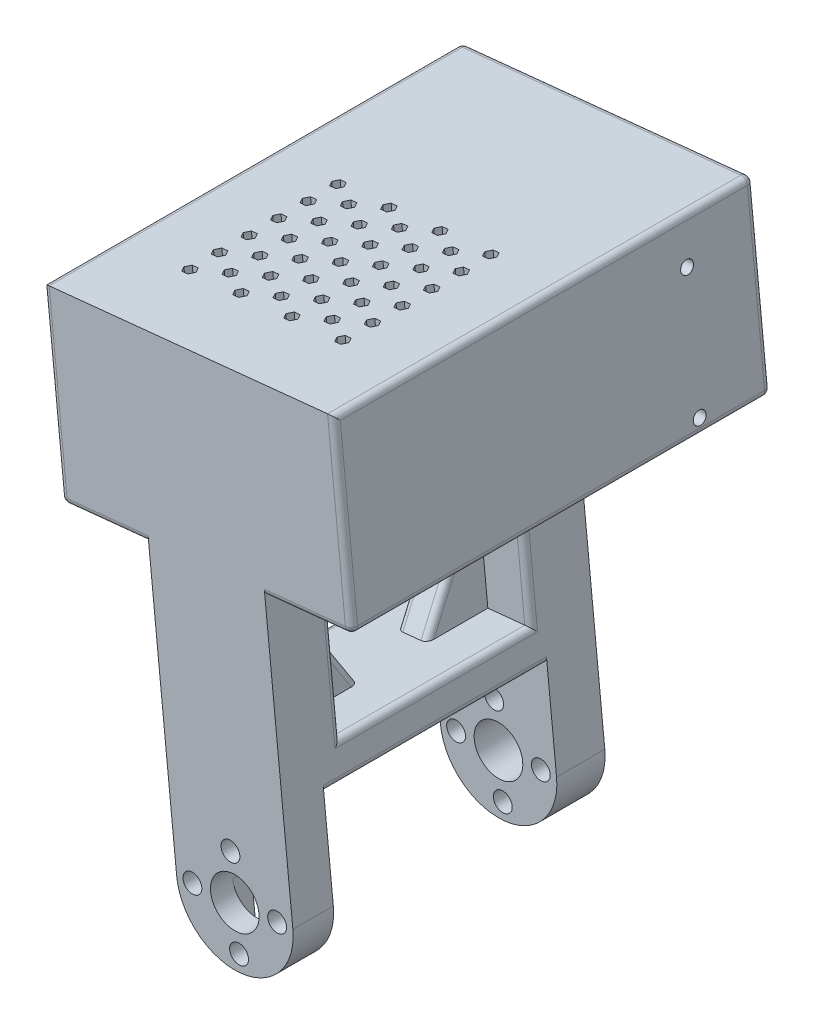
from build123d import *

# Parameters (mm, degrees)
SKETCH_1_R            = 1.55
EXTRUDE_1_DEPTH       = 50
CUT_EXTRUDE_2_REACH   = 161.914
SKETCH_2_W            = 36.7
SKETCH_2_H            = 25
EXTRUDE_START         = 1.28
SKETCH_4_R            = 1.55
EXTRUDE_2_DEPTH       = 1.28
SKETCH_5_W            = 19.2
SKETCH_5_H            = 10
EXTRUDE_3_DEPTH       = 48.978671901
EXTRUDE_4_DEPTH       = 9.4
EXTRUDE_4_DEPTH_BACK  = 28.6
SKETCH_6_W            = 51.28
SKETCH_6_H            = 24.952872663
EXTRUDE_5_DEPTH       = 29.648516482
EXTRUDE_7_DEPTH       = 5
EXTRUDE_8_DEPTH       = 5
EXTRUDE_9_DEPTH       = 5
SKETCH_15_R           = 1.05
CUT_EXTRUDE_5_DEPTH   = 7.998043226
SKETCH_17_W           = 37.211245045
SKETCH_17_H           = 31.485963651
EXTRUDE_11_DEPTH      = 4.9
CUT_EXTRUDE_START     = -7.957085393
SKETCH_16_R           = 1.05
CUT_EXTRUDE_6_DEPTH   = 7.957085393
RIB_15_REACH          = 180.646
SKETCH_26_WALL_W      = 20.054094066
SKETCH_26_WALL_H      = 5
EXTRUDE_14_DEPTH      = 2.5
EXTRUDE_14_DEPTH_BACK = 2.5
SKETCH_29_R           = 11
CUT_EXTRUDE_8_DEPTH   = 184.353804834
CUT_EXTRUDE_9_REACH   = 120.011
EXTRUDE_17_REACH      = 182.55
CUT_EXTRUDE_10_REACH  = 97.574
OTHER_START           = -77.6629689
OTHER_3_DEPTH         = 29.952872663
CUT_EXTRUDE_START_2   = -14.676203
SKETCH_34_W           = 8.000602369
SKETCH_34_H           = 3
CUT_EXTRUDE_11_DEPTH  = 9.6
CUT_EXTRUDE_START_3   = -51.28
SKETCH_35_R           = 4
CUT_EXTRUDE_12_DEPTH  = 51.28
CUT_EXTRUDE_13_DEPTH  = 183.048943079
FILLET_1_R            = 1


# Read off the part's stored shape, not the designer's step: 填充阵列3
with BuildPart() as part:
    # 草图1 → 凸台-拉伸1 (new body)
    with BuildSketch(Plane(origin=(0, 0, 106.7), x_dir=(0.9948490747861963, 0.10136724518822188, 0), z_dir=(0, 0, 1))):
        with BuildLine():
            Line((-9.975241789, 2.3862989), (-9.975241789, 23.684296999))
            Line((-9.975241789, 23.684296999), (9.224758211, 23.684296999))
            Line((9.224758211, 23.684296999), (9.224758211, 2.3862989))
            ThreePointArc((9.224758211, 2.3862989), (-0.375241789, -7.2137011), (-9.975241789, 2.3862989))
        make_face()
        with Locations(Location((-0.375241789, 9.3862989, 0), (0, 0, 354.182092032))):
            Circle(SKETCH_1_R, mode=Mode.SUBTRACT)
        with Locations(Location((6.625764906, 2.3862989, 0), (0, 0, 354.182092032))):
            Circle(SKETCH_1_R, mode=Mode.SUBTRACT)
        with Locations(Location((-7.374235094, 2.3862989, 0), (0, 0, 354.182092032))):
            Circle(SKETCH_1_R, mode=Mode.SUBTRACT)
        with Locations(Location((-0.375241789, -4.6137011, 0), (0, 0, 354.182092032))):
            Circle(SKETCH_1_R, mode=Mode.SUBTRACT)
    extrude(amount=EXTRUDE_1_DEPTH)

    # 切除-拉伸2: up to this face of the body (flat: up to its plane)
    cut_extrude_2_end = Plane(part.part.faces().sort_by_distance((-11.245212308, 11.956991324, 131.7))[0])
    # 草图2 → 切除-拉伸2 (cut, up to the picked face)
    with BuildSketch(Plane(origin=(9.177242172, 0.935088327, 0), x_dir=(0, 0, -1), z_dir=(0.9948490747861964, 0.101367245188222, 0)), mode=Mode.PRIVATE) as cut_extrude_2_sk1:
        with Locations((-131.7, 5.2862989)):
            Rectangle(SKETCH_2_W, SKETCH_2_H)
    cut_extrude_2_tool1 = split(extrude(cut_extrude_2_sk1.sketch, amount=-CUT_EXTRUDE_2_REACH, mode=Mode.PRIVATE), bisect_by=cut_extrude_2_end, keep=Keep.BOTH, mode=Mode.PRIVATE)
    add(cut_extrude_2_tool1.solids().sort_by(Axis((8.641385, 6.194158, 131.7), (-0.9948490747861964, -0.101367245188222, 0)))[0], mode=Mode.SUBTRACT)

    # 草图4 → 凸台-拉伸2 (add)
    with BuildSketch(Plane(origin=(0, 0, 106.7), x_dir=(-1, 0, 0), z_dir=(0, 0, -1)).offset(EXTRUDE_START)):
        with BuildLine():
            Line((10.16575261, 1.362844473), (12.324672005, 22.551138176))
            Line((12.324672005, 22.551138176), (-6.776430231, 24.497389284))
            Line((-6.776430231, 24.497389284), (-8.935349626, 3.30909558))
            ThreePointArc((-8.935349626, 3.30909558), (-0.357924062, -7.214581091), (10.16575261, 1.362844473))
        make_face()
        with Locations(Location((-6.349743541, 3.045642789, 0), (0, 0, 180))):
            Circle(SKETCH_4_R, mode=Mode.SUBTRACT)
        with Locations(Location((-0.094369224, -4.627973497, 0), (0, 0, 180))):
            Circle(SKETCH_4_R, mode=Mode.SUBTRACT)
        with Locations(Location((7.578143506, 1.626501356, 0), (0, 0, 180))):
            Circle(SKETCH_4_R, mode=Mode.SUBTRACT)
        with Locations(Location((1.324772208, 9.29991355, 0), (0, 0, 180))):
            Circle(SKETCH_4_R, mode=Mode.SUBTRACT)
    extrude(amount=-EXTRUDE_2_DEPTH)

    # 草图5 → 凸台-拉伸3 (add)
    with BuildSketch(Plane(origin=(-2.400811941, 23.562300956, 0), x_dir=(0.9948490747861964, 0.101367245188222, 0), z_dir=(-0.101367245188222, 0.9948490747861964, 0))):
        with Locations((-0.375241789, -151.7)):
            Rectangle(SKETCH_5_W, SKETCH_5_H)
        with Locations((-0.375241789, -110.42)):
            Rectangle(SKETCH_5_W, SKETCH_5_H)
    extrude(amount=EXTRUDE_3_DEPTH)

    # 草图6 → 凸台-拉伸4 (add, two sides: drawn at the far end of the back side and taken through both)
    with BuildSketch(Plane(origin=(9.177242172, 0.935088327, 0), x_dir=(0, 0, -1), z_dir=(0.9948490747861964, 0.101367245188222, 0)).offset(-EXTRUDE_4_DEPTH_BACK)):
        with Locations((-131.06, 60.186532569)):
            Rectangle(SKETCH_6_W, SKETCH_6_H)
    extrude(amount=EXTRUDE_4_DEPTH + EXTRUDE_4_DEPTH_BACK)

    # 草图7 → 凸台-拉伸5 (add)
    with BuildSketch(Plane(origin=(0, 0, 105.42), x_dir=(-1, 0, 0), z_dir=(0, 0, -1))):
        Polygon((23.699232685, 70.624424097), (21.169828724, 45.800081815), (24.111682391, 45.500330215), (26.641086352, 70.324672496), align=None)
        Polygon((-10.709981922, 49.048382149), (-8.18057796, 73.872724431), (-11.16317849, 74.176627814), (-13.692582451, 49.352285532), align=None)
    extrude(amount=EXTRUDE_5_DEPTH)

    # 草图11 → 凸台-拉伸7 (add)
    with BuildSketch(Plane(origin=(-7.365644985, 72.288687381, 0), x_dir=(0.9948490747861964, 0.10136724518822195, 0), z_dir=(-0.10136724518822195, 0.9948490747861964, 0))):
        Polygon((18.624758211, -156.7), (18.624758211, -75.771483518), (15.626714985, -75.771483519), (15.626714985, -105.42), (-16.418156396, -105.42), (-16.418156396, -75.771483518), (-19.375241789, -75.771483519), (-19.375241789, -156.7), align=None)
    extrude(amount=EXTRUDE_7_DEPTH)

    # 草图12 → 凸台-拉伸8 (add)
    with BuildSketch(Plane(origin=(-19.275441367, -1.964014885, 0), x_dir=(0, 0, 1), z_dir=(-0.9948490747861964, -0.101367245188222, 0))):
        Polygon((75.771483519, 77.6629689), (75.771483518, 47.710096237), (156.7, 47.710096237), (156.7, 77.6629689), align=None)
    extrude(amount=EXTRUDE_8_DEPTH)

    # 草图13 → 凸台-拉伸9 (add)
    with BuildSketch(Plane(origin=(18.528823475, 1.887940432, 0), x_dir=(0, 0, -1), z_dir=(0.9948490747861964, 0.101367245188222, 0))):
        Polygon((-75.771483517, 47.710096237), (-75.771483518, 77.6629689), (-156.7, 77.6629689), (-156.7, 47.710096237), align=None)
    extrude(amount=EXTRUDE_9_DEPTH)

    # 草图15 → 切除-拉伸5 (cut)
    with BuildSketch(Plane(origin=(23.503068848, 2.394776658, 0), x_dir=(0, 0, -1), z_dir=(0.9948490747861964, 0.10136724518822214, 0))):
        with Locations(Location((-78.61, 70.5529689, 0), (0, 0, 90))):
            Circle(SKETCH_15_R)
        with Locations(Location((-78.61, 50.0529689, 0), (0, 0, 90))):
            Circle(SKETCH_15_R)
        with Locations(Location((-99.31, 50.0529689, 0), (0, 0, 90))):
            Circle(SKETCH_15_R)
        with Locations(Location((-99.31, 70.5529689, 0), (0, 0, 90))):
            Circle(SKETCH_15_R)
    extrude(amount=-CUT_EXTRUDE_5_DEPTH, mode=Mode.SUBTRACT)

    # 草图17 → 凸台-拉伸11 (add)
    with BuildSketch(Plane(origin=(-7.872481211, 77.262932755, 0), x_dir=(0.9948490747861964, 0.10136724518822186, 0), z_dir=(-0.10136724518822186, 0.9948490747861964, 0))):
        with Locations((-0.493857693, -91.514465344)):
            Rectangle(SKETCH_17_W, SKETCH_17_H)
    extrude(amount=-EXTRUDE_11_DEPTH)

    # 草图16 → 切除-拉伸6 (cut)
    with BuildSketch(Plane(origin=(-24.249686741, -2.470851111, 0), x_dir=(0, 0, 1), z_dir=(-0.9948490747861964, -0.1013672451882219, 0)).offset(CUT_EXTRUDE_START)):
        with Locations(Location((103.06, 70.5529689, 0), (0, 0, 270))):
            Circle(SKETCH_16_R)
        with Locations(Location((103.06, 50.0529689, 0), (0, 0, 270))):
            Circle(SKETCH_16_R)
        with Locations(Location((78.61, 50.0529689, 0), (0, 0, 90))):
            Circle(SKETCH_16_R)
        with Locations(Location((78.61, 70.5529689, 0), (0, 0, 90))):
            Circle(SKETCH_16_R)
    extrude(amount=CUT_EXTRUDE_6_DEPTH, mode=Mode.SUBTRACT)

    # 草图26 wall → 筋15 (add, up to next)
    with BuildSketch(Plane(origin=(-3.655151383, 32.170965845, 120.42), x_dir=(0.08786539976, -0.862337843509, 0.498651296176), z_dir=(-0.050546908203, 0.496082780642, 0.866802679289)), mode=Mode.PRIVATE) as rib_15_sk1:
        Rectangle(SKETCH_26_WALL_W, SKETCH_26_WALL_H)
    rib_15_tool1 = extrude(rib_15_sk1.sketch, amount=-RIB_15_REACH, mode=Mode.PRIVATE) - part.part
    add(rib_15_tool1.solids().sort_by_distance((-3.655151383, 32.170965845, 120.42))[0])

    # 草图27 → 凸台-拉伸14 (add, two sides: drawn at the far end of the back side and taken through both)
    with BuildSketch(Plane(origin=(-0.373308946, -0.038037226, 0), x_dir=(0, 0, 1), z_dir=(-0.9948490747861964, -0.10136724518822203, 0)).offset(-EXTRUDE_14_DEPTH_BACK)):
        Polygon((146.7, 40.169897533), (136.7, 23.684296999), (135.962846636, 22.751091269), (148.081754262, 22.485514373), (147.144651746, 40.719926342), align=None)
    extrude(amount=EXTRUDE_14_DEPTH + EXTRUDE_14_DEPTH_BACK)

    # 草图29 → 切除-拉伸8 (cut, through all)
    with BuildSketch(Plane(origin=(23.503068848, 2.394776658, 0), x_dir=(0, 0, -1), z_dir=(0.9948490747861964, 0.10136724518822199, 0))):
        with Locations((-70.31, 60.3029689)):
            Circle(SKETCH_29_R)
    extrude(amount=-CUT_EXTRUDE_8_DEPTH, mode=Mode.SUBTRACT)

    # 切除-拉伸9: up to this face of the body (flat: up to its plane)
    cut_extrude_9_end = Plane(part.part.faces().sort_by_distance((-4.342772278, 38.828672746, 105.42))[0])
    # 草图30 → 切除-拉伸9 (cut, up to the picked face)
    with BuildSketch(Plane(origin=(1e-09, -5e-09, 75.771483514), x_dir=(-1.0, 0, 7.327943828065848e-12), z_dir=(-7.327943828065848e-12, 7.191747867590728e-11, -1.0)), mode=Mode.PRIVATE) as cut_extrude_9_sk1:
        Polygon((-10.48945375, 68.969928242), (-7.703876341, 68.686099956), (-9.17337973, 54.263945297), (-11.95895714, 54.547773584), align=None)
    cut_extrude_9_tool1 = split(extrude(cut_extrude_9_sk1.sketch, amount=-CUT_EXTRUDE_9_REACH, mode=Mode.PRIVATE), bisect_by=cut_extrude_9_end, keep=Keep.BOTH, mode=Mode.PRIVATE)
    # 草图30 → 切除-拉伸9 (cut, up to the picked face)
    with BuildSketch(Plane(origin=(1e-09, -5e-09, 75.771483514), x_dir=(-1.0, 0, 7.327943828065848e-12), z_dir=(-7.327943828065848e-12, 7.191747867590728e-11, -1.0)), mode=Mode.PRIVATE) as cut_extrude_9_sk2:
        Polygon((26.066177696, 67.568753878), (22.801665743, 67.901381803), (20.966211547, 48.936879344), (23.963981716, 48.631430295), align=None)
    cut_extrude_9_tool2 = split(extrude(cut_extrude_9_sk2.sketch, amount=-CUT_EXTRUDE_9_REACH, mode=Mode.PRIVATE), bisect_by=cut_extrude_9_end, keep=Keep.BOTH, mode=Mode.PRIVATE)
    add(cut_extrude_9_tool1.solids().sort_by(Axis((9.831417, 61.616937, 75.771484), (7.327943828065848e-12, -7.191747867590728e-11, 1.0)))[0], mode=Mode.SUBTRACT)
    add(cut_extrude_9_tool2.solids().sort_by(Axis((-23.463486, 58.394147, 75.771484), (7.327943828065848e-12, -7.191747867590728e-11, 1.0)))[0], mode=Mode.SUBTRACT)

    # 凸台-拉伸17: up to this plane
    extrude_17_end = Plane(origin=(-23.699232685, 70.624424097, 50.04579745), z_dir=(-0.9948490747861964, -0.10136724518822147, 0))
    # 草图31 → 凸台-拉伸17 (add, up to the surface)
    with BuildSketch(Plane(origin=(-18.339505927, -2.035833388, 0), x_dir=(0, 0, -1), z_dir=(0.9938949685030578, 0.1103303747129772, 6.514758705377157e-13)), mode=Mode.PRIVATE) as extrude_17_sk1:
        with BuildLine():
            Line((-102.268545644, 70.032135652), (-100.037288328, 70.165587631))
            Line((-100.037288328, 70.165587631), (-100.037288328, 50.978488956))
            Line((-100.037288328, 50.978488956), (-102.332498663, 50.978488956))
            add(Edge.make_bspline(
                [(-102.332498663, 50.978488956), (-103.06, 51.677551941), (-103.787501337, 50.978488956)],
                knots=[5.517739654, 5.517739654, 5.517739654, 7.04863096, 7.04863096, 7.04863096], degree=2, weights=[1, 0.721073655, 1]))
            Line((-103.787501337, 50.978488956), (-105.42, 50.978488956))
            Line((-105.42, 50.978488956), (-105.42, 70.032135652))
            Line((-105.42, 70.032135652), (-103.851454356, 70.032135652))
            add(Edge.make_bspline(
                [(-103.851454356, 70.032135652), (-103.06, 69.124272691), (-102.268545644, 70.032135652)],
                knots=[2.287818307, 2.287818307, 2.287818307, 3.995367, 3.995367, 3.995367], degree=2, weights=[1, 0.657142859, 1]))
        make_face()
    extrude_17_tool1 = split(extrude(extrude_17_sk1.sketch, amount=EXTRUDE_17_REACH, mode=Mode.PRIVATE), bisect_by=extrude_17_end, keep=Keep.BOTH, mode=Mode.PRIVATE)
    add(extrude_17_tool1.solids().sort_by_distance((-25.015594, 58.104724, 102.723566))[0])
    # 草图31 → 凸台-拉伸17 (add, up to the surface)
    with BuildSketch(Plane(origin=(-18.339505927, -2.035833388, 0), x_dir=(0, 0, -1), z_dir=(0.9938949685030578, 0.1103303747129772, 6.514758705377157e-13)), mode=Mode.PRIVATE) as extrude_17_sk2:
        with BuildLine():
            Line((-79.401454357, 70.032135654), (-86.232448787, 70.282417574))
            Line((-86.232448787, 70.282417574), (-86.232448787, 50.978488958))
            Line((-86.232448787, 50.978488958), (-79.337501335, 50.978488958))
            add(Edge.make_bspline(
                [(-77.882498665, 50.978488958), (-78.61, 51.677551938), (-79.337501335, 50.978488958)],
                knots=[5.517739657, 5.517739657, 5.517739657, 7.048630958, 7.048630958, 7.048630958], degree=2, weights=[1, 0.721073656, 1]))
            Line((-77.882498665, 50.978488958), (-75.86746063, 50.978488958))
            add(Edge.make_bspline(
                [(-75.771483519, 70.020548548), (-92.271618876, 60.582448743), (-75.86746063, 50.978488958)],
                knots=[3.661152944, 3.661152944, 3.661152944, 5.753544153, 5.753544153, 5.753544153], degree=2, weights=[1, 0.50086746, 1]))
            Line((-75.771483519, 70.020548548), (-75.771483519, 70.032135654))
            Line((-75.771483519, 70.032135654), (-77.818545643, 70.032135654))
            add(Edge.make_bspline(
                [(-79.401454357, 70.032135654), (-78.61, 69.124272687), (-77.818545643, 70.032135654)],
                knots=[2.287818305, 2.287818305, 2.287818305, 3.995367002, 3.995367002, 3.995367002], degree=2, weights=[1, 0.657142857, 1]))
        make_face()
    extrude_17_tool2 = split(extrude(extrude_17_sk2.sketch, amount=EXTRUDE_17_REACH, mode=Mode.PRIVATE), bisect_by=extrude_17_end, keep=Keep.BOTH, mode=Mode.PRIVATE)
    add(extrude_17_tool2.solids().sort_by_distance((-25.023733, 58.178042, 82.820138))[0])

    # 草图32 → 切除-拉伸10 (cut, up to next)
    with BuildSketch(Plane(origin=(-28.477001815, 39.017308915, 87.635), x_dir=(0.10136724518822199, -0.9948490747861964, 0), z_dir=(0.9948490747861964, 0.10136724518822199, 0)), mode=Mode.PRIVATE) as cut_extrude_10_sk1:
        Polygon((-8.107127337, 6.363516482), (-8.107127337, -0.136483518), (-28.76, -0.136483518), (-28.76, 6.363516482), (-24.51, 6.363516482), (-24.51, 9.974684065), (-12.357127337, 9.974684065), (-12.357127337, 6.363516482), align=None)
    cut_extrude_10_tool1 = extrude(cut_extrude_10_sk1.sketch, amount=CUT_EXTRUDE_10_REACH, mode=Mode.PRIVATE) & part.part
    add(cut_extrude_10_tool1.solids().sort_by_distance((-30.345561, 57.355923, 83.275933))[0], mode=Mode.SUBTRACT)

    # 填充阵列3 outline → 填充阵列3 (cut)
    with BuildSketch(Plane(origin=(0, 0, 0), x_dir=(0.9948490747861963, 0.10136724518822193, 0), z_dir=(0.10136724518822193, -0.9948490747861963, 0)).offset(OTHER_START)):
        Polygon((13.26030628, 143.858561798), (12.76030628, 144.724587202), (11.76030628, 144.724587202), (11.26030628, 143.858561798), (11.76030628, 142.992536394), (12.76030628, 142.992536394), align=None)
        Polygon((-12.510789858, 144.724587202), (-13.510789858, 144.724587202), (-14.010789858, 143.858561798), (-13.510789858, 142.992536394), (-12.510789858, 142.992536394), (-12.010789858, 143.858561798), align=None)
        Polygon((-4.087091145, 144.724587202), (-5.087091145, 144.724587202), (-5.587091145, 143.858561798), (-5.087091145, 142.992536394), (-4.087091145, 142.992536394), (-3.587091145, 143.858561798), align=None)
        Polygon((4.336607568, 144.724587202), (3.336607568, 144.724587202), (2.836607568, 143.858561798), (3.336607568, 142.992536394), (4.336607568, 142.992536394), (4.836607568, 143.858561798), align=None)
        Polygon((-0.875241789, 122.839175965), (-1.375241789, 121.973150561), (-0.875241789, 121.107125158), (0.124758211, 121.107125158), (0.624758211, 121.973150561), (0.124758211, 122.839175965), align=None)
        Polygon((3.336607568, 130.134313044), (2.836607568, 129.26828764), (3.336607568, 128.402262237), (4.336607568, 128.402262237), (4.836607568, 129.26828764), (4.336607568, 130.134313044), align=None)
        Polygon((7.548456924, 137.429450123), (7.048456924, 136.563424719), (7.548456924, 135.697399315), (8.548456924, 135.697399315), (9.048456924, 136.563424719), (8.548456924, 137.429450123), align=None)
        Polygon((13.26030628, 129.26828764), (12.76030628, 130.134313044), (11.76030628, 130.134313044), (11.26030628, 129.26828764), (11.76030628, 128.402262237), (12.76030628, 128.402262237), align=None)
        Polygon((-12.510789858, 130.134313044), (-13.510789858, 130.134313044), (-14.010789858, 129.26828764), (-13.510789858, 128.402262237), (-12.510789858, 128.402262237), (-12.010789858, 129.26828764), align=None)
        Polygon((-4.087091145, 130.134313044), (-5.087091145, 130.134313044), (-5.587091145, 129.26828764), (-5.087091145, 128.402262237), (-4.087091145, 128.402262237), (-3.587091145, 129.26828764), align=None)
        Polygon((7.548456924, 122.839175965), (7.048456924, 121.973150561), (7.548456924, 121.107125158), (8.548456924, 121.107125158), (9.048456924, 121.973150561), (8.548456924, 122.839175965), align=None)
        Polygon((0.624758211, 136.563424719), (0.124758211, 137.429450123), (-0.875241789, 137.429450123), (-1.375241789, 136.563424719), (-0.875241789, 135.697399315), (0.124758211, 135.697399315), align=None)
        Polygon((-8.298940501, 122.839175965), (-9.298940501, 122.839175965), (-9.798940501, 121.973150561), (-9.298940501, 121.107125158), (-8.298940501, 121.107125158), (-7.798940501, 121.973150561), align=None)
        Polygon((9.048456924, 126.836575281), (8.548456924, 127.702600685), (7.548456924, 127.702600685), (7.048456924, 126.836575281), (7.548456924, 125.970549877), (8.548456924, 125.970549877), align=None)
        Polygon((13.26030628, 119.541438202), (12.76030628, 120.407463606), (11.76030628, 120.407463606), (11.26030628, 119.541438202), (11.76030628, 118.675412798), (12.76030628, 118.675412798), align=None)
        Polygon((0.624758211, 141.426849439), (0.124758211, 142.292874842), (-0.875241789, 142.292874842), (-1.375241789, 141.426849439), (-0.875241789, 140.560824035), (0.124758211, 140.560824035), align=None)
        Polygon((4.836607568, 134.13171236), (4.336607568, 134.997737763), (3.336607568, 134.997737763), (2.836607568, 134.13171236), (3.336607568, 133.265686956), (4.336607568, 133.265686956), align=None)
        Polygon((-8.298940501, 127.702600685), (-9.298940501, 127.702600685), (-9.798940501, 126.836575281), (-9.298940501, 125.970549877), (-8.298940501, 125.970549877), (-7.798940501, 126.836575281), align=None)
        Polygon((0.124758211, 127.702600685), (-0.875241789, 127.702600685), (-1.375241789, 126.836575281), (-0.875241789, 125.970549877), (0.124758211, 125.970549877), (0.624758211, 126.836575281), align=None)
        Polygon((11.76030628, 134.997737763), (11.26030628, 134.13171236), (11.76030628, 133.265686956), (12.76030628, 133.265686956), (13.26030628, 134.13171236), (12.76030628, 134.997737763), align=None)
        Polygon((3.336607568, 120.407463606), (2.836607568, 119.541438202), (3.336607568, 118.675412798), (4.336607568, 118.675412798), (4.836607568, 119.541438202), (4.336607568, 120.407463606), align=None)
        Polygon((9.048456924, 131.7), (8.548456924, 132.566025404), (7.548456924, 132.566025404), (7.048456924, 131.7), (7.548456924, 130.833974596), (8.548456924, 130.833974596), align=None)
        Polygon((13.26030628, 124.404862921), (12.76030628, 125.270888325), (11.76030628, 125.270888325), (11.26030628, 124.404862921), (11.76030628, 123.538837517), (12.76030628, 123.538837517), align=None)
        Polygon((4.836607568, 138.995137079), (4.336607568, 139.861162483), (3.336607568, 139.861162483), (2.836607568, 138.995137079), (3.336607568, 138.129111675), (4.336607568, 138.129111675), align=None)
        Polygon((-8.298940501, 132.566025404), (-9.298940501, 132.566025404), (-9.798940501, 131.7), (-9.298940501, 130.833974596), (-8.298940501, 130.833974596), (-7.798940501, 131.7), align=None)
        Polygon((0.124758211, 132.566025404), (-0.875241789, 132.566025404), (-1.375241789, 131.7), (-0.875241789, 130.833974596), (0.124758211, 130.833974596), (0.624758211, 131.7), align=None)
        Polygon((11.76030628, 139.861162483), (11.26030628, 138.995137079), (11.76030628, 138.129111675), (12.76030628, 138.129111675), (13.26030628, 138.995137079), (12.76030628, 139.861162483), align=None)
        Polygon((3.336607568, 125.270888325), (2.836607568, 124.404862921), (3.336607568, 123.538837517), (4.336607568, 123.538837517), (4.836607568, 124.404862921), (4.336607568, 125.270888325), align=None)
        Polygon((-12.510789858, 125.270888325), (-13.510789858, 125.270888325), (-14.010789858, 124.404862921), (-13.510789858, 123.538837517), (-12.510789858, 123.538837517), (-12.010789858, 124.404862921), align=None)
        Polygon((-4.087091145, 125.270888325), (-5.087091145, 125.270888325), (-5.587091145, 124.404862921), (-5.087091145, 123.538837517), (-4.087091145, 123.538837517), (-3.587091145, 124.404862921), align=None)
        Polygon((-12.510789858, 120.407463606), (-13.510789858, 120.407463606), (-14.010789858, 119.541438202), (-13.510789858, 118.675412798), (-12.510789858, 118.675412798), (-12.010789858, 119.541438202), align=None)
        Polygon((-4.087091145, 120.407463606), (-5.087091145, 120.407463606), (-5.587091145, 119.541438202), (-5.087091145, 118.675412798), (-4.087091145, 118.675412798), (-3.587091145, 119.541438202), align=None)
        Polygon((9.048456924, 141.426849439), (8.548456924, 142.292874842), (7.548456924, 142.292874842), (7.048456924, 141.426849439), (7.548456924, 140.560824035), (8.548456924, 140.560824035), align=None)
        Polygon((-8.298940501, 142.292874842), (-9.298940501, 142.292874842), (-9.798940501, 141.426849439), (-9.298940501, 140.560824035), (-8.298940501, 140.560824035), (-7.798940501, 141.426849439), align=None)
        Polygon((-5.087091145, 134.997737763), (-5.587091145, 134.13171236), (-5.087091145, 133.265686956), (-4.087091145, 133.265686956), (-3.587091145, 134.13171236), (-4.087091145, 134.997737763), align=None)
        Polygon((-13.510789858, 134.997737763), (-14.010789858, 134.13171236), (-13.510789858, 133.265686956), (-12.510789858, 133.265686956), (-12.010789858, 134.13171236), (-12.510789858, 134.997737763), align=None)
        Polygon((-7.798940501, 136.563424719), (-8.298940501, 137.429450123), (-9.298940501, 137.429450123), (-9.798940501, 136.563424719), (-9.298940501, 135.697399315), (-8.298940501, 135.697399315), align=None)
        Polygon((-12.510789858, 139.861162483), (-13.510789858, 139.861162483), (-14.010789858, 138.995137079), (-13.510789858, 138.129111675), (-12.510789858, 138.129111675), (-12.010789858, 138.995137079), align=None)
        Polygon((-4.087091145, 139.861162483), (-5.087091145, 139.861162483), (-5.587091145, 138.995137079), (-5.087091145, 138.129111675), (-4.087091145, 138.129111675), (-3.587091145, 138.995137079), align=None)
    extrude(amount=OTHER_3_DEPTH, mode=Mode.SUBTRACT)

    # 草图34 → 切除-拉伸11 (cut)
    with BuildSketch(Plane(origin=(1.245793688, -12.226599388, 0), x_dir=(-0.9948490747861964, -0.10136724518822099, 0), z_dir=(0.10136724518822099, -0.9948490747861964, 0)).offset(CUT_EXTRUDE_START_2)):
        with Locations((0.374940605, -151.55)):
            Rectangle(SKETCH_34_W, SKETCH_34_H)
    extrude(amount=CUT_EXTRUDE_11_DEPTH, mode=Mode.SUBTRACT)

    # 草图35 → 切除-拉伸12 (cut)
    with BuildSketch(Plane(origin=(0, 0, 105.42), x_dir=(-1, 0, 0), z_dir=(0, 0, -1)).offset(CUT_EXTRUDE_START_3)):
        with Locations(Location((0.615201492, 2.335970027, 0), (0, 0, 174.182092032))):
            Circle(SKETCH_35_R)
    extrude(amount=CUT_EXTRUDE_12_DEPTH, mode=Mode.SUBTRACT)

    # 草图36 → 切除-拉伸13 (cut, through all)
    with BuildSketch(Plane(origin=(-24.249686741, -2.470851111, 0), x_dir=(0, 0, 1), z_dir=(-0.9948490747861964, -0.10136724518822199, 0))):
        Polygon((87.771483518, 70.4629689), (87.771483518, 37.799119807), (62.597375519, 37.799119807), (62.597375519, 84.896221871), (87.771483518, 84.896221871), align=None)
    extrude(amount=-CUT_EXTRUDE_13_DEPTH, mode=Mode.SUBTRACT)

    # 圆角1
    fillet_1_edges = [part.edges().sort_by_distance(p)[0] for p in [
        (-13.542386546, 34.502160248, 146.7),
        (5.558715689, 36.448411355, 146.7),
        (5.558715689, 36.448411355, 115.42),
        (-13.542386546, 34.502160248, 115.42),
        (11.503914487, 49.129277592, 156.7),
        (-21.923014426, 45.723338154, 156.7),
        (15.630587638, 79.657709414, 122.235741759),
        (-29.085927764, 44.993493989, 122.235741759),
        (-25.127878244, 45.396787902, 87.771483518),
        (-8.245790157, 77.224895529, 87.771483518),
        (14.688404873, 49.453751953, 87.771483518),
        (17.148707732, 64.758415586, 87.771483518),
        (-32.122167952, 74.792081644, 122.235741759),
        (-30.604047858, 59.892787817, 156.7),
        (18.666827825, 49.859121758, 122.235741759),
        (17.148707732, 64.758415586, 156.7),
        (-6.14227407, 31.917547732, 120.42),
        (-1.168028696, 32.424383958, 120.42),
        (-6.09679353, 31.471187836, 141.7),
        (-1.122548156, 31.978024062, 141.7),
        (-11.726808186, 16.683520224, 131.7),
        (7.37429405, 18.629771332, 131.7),
        (-30.604047858, 59.892787817, 87.771483518),
        (6.776430231, 24.497389284, 131.06),
        (-12.324672005, 22.551138176, 131.06),
    ]]
    fillet(fillet_1_edges, radius=FILLET_1_R)


solid = part.part
